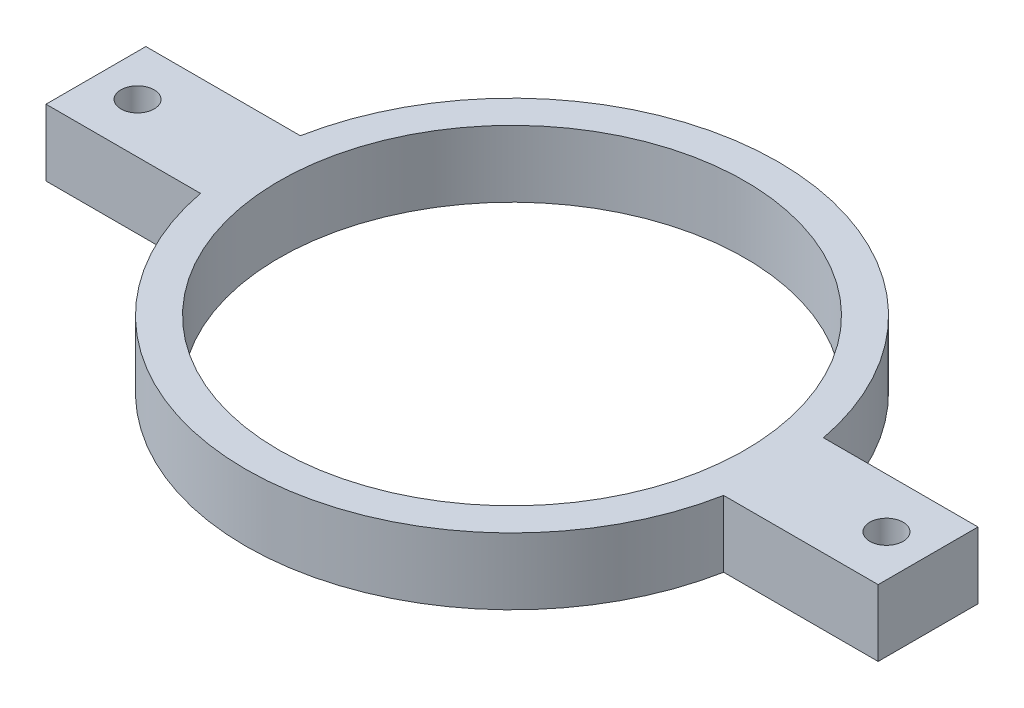
from build123d import *

# Parameters (mm, degrees)
SKETCH1_R           = 0.5
SKETCH1_R_2         = 7
BOSS_EXTRUDE1_DEPTH = 1


with BuildPart() as part:
    # Sketch1 → Boss-Extrude1 (new, symmetric)
    with BuildSketch(Plane(origin=(0, 0, 0), x_dir=(1, 0, 0), z_dir=(0, 1, 0))):
        with BuildLine():
            Line((-12.5, 1.5), (-12.5, -1.5))
            Line((-12.5, -1.5), (-7.858116823, -1.5))
            ThreePointArc((-7.858116823, -1.5), (0, -8), (7.858116823, -1.5))
            Line((7.858116823, -1.5), (12.5, -1.5))
            Line((12.5, -1.5), (12.5, 1.5))
            Line((12.5, 1.5), (7.858116823, 1.5))
            ThreePointArc((7.858116823, 1.5), (0, 8), (-7.858116823, 1.5))
            Line((-7.858116823, 1.5), (-12.5, 1.5))
        make_face()
        with Locations((-11.25, 0)):
            Circle(SKETCH1_R, mode=Mode.SUBTRACT)
        Circle(SKETCH1_R_2, mode=Mode.SUBTRACT)
        with Locations((11.25, 0)):
            Circle(SKETCH1_R, mode=Mode.SUBTRACT)
    extrude(amount=BOSS_EXTRUDE1_DEPTH, both=True)


solid = part.part
